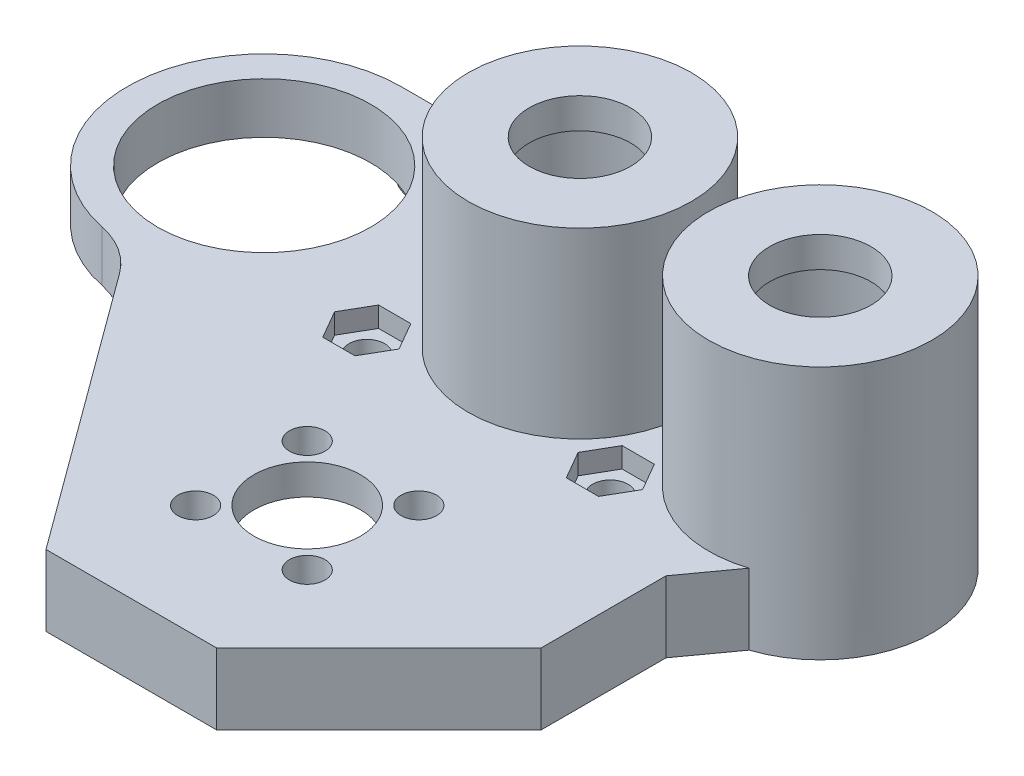
from build123d import *

# Parameters (mm, degrees)
SKETCH3_R               = 8
SKETCH3_W               = 54.803
SKETCH3_H               = 30
SKETCH3_R_2             = 5.25
BOSS_EXTRUDE1_DEPTH     = 7
CUT_EXTRUDE3_DEPTH      = 63.702230973
CUT_EXTRUDE3_DEPTH_BACK = 63.702230973
SKETCH4_R               = 1.75
SKETCH6_R               = 11
SKETCH6_R_2             = 8
BOSS_EXTRUDE2_DEPTH     = 15
SKETCH7_R               = 11
SKETCH7_R_2             = 5
BOSS_EXTRUDE3_DEPTH     = 3
CHAMFER1_SIZE           = 2.5
CUT_EXTRUDE4_DEPTH      = 2
CUT_EXTRUDE5_DEPTH      = 68.138437344
CUT_EXTRUDE5_DEPTH_BACK = 68.138437344
SKETCH9_R               = 1.75
CUT_EXTRUDE6_START      = -2
SKETCH10_R              = 1.75
CUT_EXTRUDE6_DEPTH      = 2
CHAMFER3_SIZE           = 30
CHAMFER3_SIZE2          = 22
CHAMFER4_SIZE           = 16
FILLET1_R               = 8
SKETCH14_R              = 11.5
SKETCH14_R_2            = 5.25
SKETCH14_R_3            = 1.75
CUT_EXTRUDE8_DEPTH      = 4
FILLET2_R               = 3


with BuildPart() as part:
    # Sketch3 → Boss-Extrude1 (new body)
    # profile 1 of 10: a face of its own
    with BuildSketch(Plane(origin=(0, 0, 0), x_dir=(1, 0, 0), z_dir=(0, 1, 0))):
        with BuildLine():
            ThreePointArc((-17.613, 0), (-21.567058454, 9.545941546), (-31.113, 13.5))
            Line((-31.113, 13.5), (-31.113, 10.5))
            ThreePointArc((-31.113, 10.5), (-23.688378798, 7.424621202), (-20.613, 0))
            ThreePointArc((-20.613, 0), (-23.688378798, -7.424621202), (-31.113, -10.5))
            Line((-31.113, -10.5), (-31.113, -13.5))
            ThreePointArc((-31.113, -13.5), (-21.567058454, -9.545941546), (-17.613, 0))
        make_face()
    # profile 2 of 10: a face of its own
    with BuildSketch(Plane(origin=(0, 0, 0), x_dir=(1, 0, 0), z_dir=(0, 1, 0))):
        with BuildLine():
            Line((-31.113, 10.5), (-31.113, 13.5))
            ThreePointArc((-31.113, 13.5), (-44.613, 0), (-31.113, -13.5))
            Line((-31.113, -13.5), (-31.113, -10.5))
            ThreePointArc((-31.113, -10.5), (-41.613, 0), (-31.113, 10.5))
        make_face()
    # profile 3 of 10: a face of its own
    with BuildSketch(Plane(origin=(0, 0, 0), x_dir=(1, 0, 0), z_dir=(0, 1, 0))):
        with BuildLine():
            Line((23.69, 13.5), (-31.113, 13.5))
            ThreePointArc((-31.113, 13.5), (-21.567058454, 9.545941546), (-17.613, 0))
            ThreePointArc((-17.613, 0), (-21.567058454, -9.545941546), (-31.113, -13.5))
            Line((-31.113, -13.5), (23.69, -13.5))
            Line((23.69, -13.5), (23.69, -11))
            ThreePointArc((23.69, -11), (12.69, 0), (23.69, 11))
            Line((23.69, 11), (23.69, 13.5))
        make_face()
        with Locations(Location((0, 0, 0), (0, 0, 270))):
            Circle(SKETCH3_R, mode=Mode.SUBTRACT)
    # profile 4 of 10: a face of its own
    with BuildSketch(Plane(origin=(0, 0, 0), x_dir=(1, 0, 0), z_dir=(0, 1, 0))):
        with BuildLine():
            ThreePointArc((-17.613, 0), (-21.567058454, 9.545941546), (-31.113, 13.5))
            Line((-31.113, 13.5), (-31.113, 10.5))
            ThreePointArc((-31.113, 10.5), (-23.688378798, 7.424621202), (-20.613, 0))
            ThreePointArc((-20.613, 0), (-23.688378798, -7.424621202), (-31.113, -10.5))
            Line((-31.113, -10.5), (-31.113, -13.5))
            ThreePointArc((-31.113, -13.5), (-21.567058454, -9.545941546), (-17.613, 0))
        make_face()
    # profile 5 of 10: a face of its own
    with BuildSketch(Plane(origin=(0, 0, 0), x_dir=(1, 0, 0), z_dir=(0, 1, 0))):
        with BuildLine():
            Line((-31.113, 10.5), (-31.113, 13.5))
            ThreePointArc((-31.113, 13.5), (-44.613, 0), (-31.113, -13.5))
            Line((-31.113, -13.5), (-31.113, -10.5))
            ThreePointArc((-31.113, -10.5), (-41.613, 0), (-31.113, 10.5))
        make_face()
    # profile 6 of 10: a face of its own
    with BuildSketch(Plane(origin=(0, 0, 0), x_dir=(1, 0, 0), z_dir=(0, 1, 0))):
        with BuildLine():
            ThreePointArc((34.69, 0), (31.468174593, 7.778174593), (23.69, 11))
            Line((23.69, 11), (23.69, 8))
            ThreePointArc((23.69, 8), (29.346854249, 5.656854249), (31.69, 0))
            ThreePointArc((31.69, 0), (29.346854249, -5.656854249), (23.69, -8))
            Line((23.69, -8), (23.69, -11))
            ThreePointArc((23.69, -11), (31.468174593, -7.778174593), (34.69, 0))
        make_face()
    # profile 7 of 10: a face of its own
    with BuildSketch(Plane(origin=(0, 0, 0), x_dir=(1, 0, 0), z_dir=(0, 1, 0))):
        with BuildLine():
            Line((23.69, 8), (23.69, 11))
            ThreePointArc((23.69, 11), (12.69, 0), (23.69, -11))
            Line((23.69, -11), (23.69, -8))
            ThreePointArc((23.69, -8), (15.69, 0), (23.69, 8))
        make_face()
    # profile 8 of 10: a face of its own
    with BuildSketch(Plane(origin=(0, 0, 0), x_dir=(1, 0, 0), z_dir=(0, 1, 0))):
        with Locations((-3.7115, -28.5)):
            Rectangle(SKETCH3_W, SKETCH3_H)
        with Locations(Location((0, -26.87, 0), (0, 0, 270))):
            Circle(SKETCH3_R_2, mode=Mode.SUBTRACT)
    # profile 9 of 10: a face of its own
    with BuildSketch(Plane(origin=(0, 0, 0), x_dir=(1, 0, 0), z_dir=(0, 1, 0))):
        with BuildLine():
            ThreePointArc((34.69, 0), (31.468174593, 7.778174593), (23.69, 11))
            Line((23.69, 11), (23.69, 8))
            ThreePointArc((23.69, 8), (29.346854249, 5.656854249), (31.69, 0))
            ThreePointArc((31.69, 0), (29.346854249, -5.656854249), (23.69, -8))
            Line((23.69, -8), (23.69, -11))
            ThreePointArc((23.69, -11), (31.468174593, -7.778174593), (34.69, 0))
        make_face()
    # profile 10 of 10: a face of its own
    with BuildSketch(Plane(origin=(0, 0, 0), x_dir=(1, 0, 0), z_dir=(0, 1, 0))):
        with BuildLine():
            Line((23.69, 8), (23.69, 11))
            ThreePointArc((23.69, 11), (12.69, 0), (23.69, -11))
            Line((23.69, -11), (23.69, -8))
            ThreePointArc((23.69, -8), (15.69, 0), (23.69, 8))
        make_face()
    extrude(amount=BOSS_EXTRUDE1_DEPTH)

    # Sketch4 → Cut-Extrude3 (cut, two sides: drawn at the far end of the back side and taken through both)
    with BuildSketch(Plane(origin=(0, 0, 0), x_dir=(1, 0, 0), z_dir=(0, 1, 0)).offset(-CUT_EXTRUDE3_DEPTH_BACK)):
        with Locations(Location((5.5, -21.37, 0), (0, 0, 270))):
            Circle(SKETCH4_R)
        with Locations(Location((5.5, -32.37, 0), (0, 0, 270))):
            Circle(SKETCH4_R)
        with Locations(Location((-5.5, -32.37, 0), (0, 0, 270))):
            Circle(SKETCH4_R)
        with Locations(Location((-5.5, -21.37, 0), (0, 0, 270))):
            Circle(SKETCH4_R)
    extrude(amount=CUT_EXTRUDE3_DEPTH + CUT_EXTRUDE3_DEPTH_BACK, mode=Mode.SUBTRACT)

    # Sketch6 → Boss-Extrude2 (add)
    # profile 1 of 2: a face of its own
    with BuildSketch(Plane(origin=(0, 7, 0), x_dir=(1, 0, 0), z_dir=(0, 1, 0))):
        with Locations(Location((23.69, 0, 0), (0, 0, 270))):
            Circle(SKETCH6_R)
        with Locations(Location((23.69, 0, 0), (0, 0, 270))):
            Circle(SKETCH6_R_2, mode=Mode.SUBTRACT)
    # profile 2 of 2: a face of its own
    with BuildSketch(Plane(origin=(0, 7, 0), x_dir=(1, 0, 0), z_dir=(0, 1, 0))):
        with Locations(Location((0, 0, 0), (0, 0, 270))):
            Circle(SKETCH6_R)
        with Locations(Location((0, 0, 0), (0, 0, 270))):
            Circle(SKETCH6_R_2, mode=Mode.SUBTRACT)
    extrude(amount=BOSS_EXTRUDE2_DEPTH)

    # Sketch7 → Boss-Extrude3 (add)
    # profile 1 of 2: a face of its own
    with BuildSketch(Plane(origin=(0, 22, 0), x_dir=(1, 0, 0), z_dir=(0, 1, 0))):
        with Locations(Location((23.69, 0, 0), (0, 0, 270))):
            Circle(SKETCH7_R)
        with Locations(Location((23.69, 0, 0), (0, 0, 270))):
            Circle(SKETCH7_R_2, mode=Mode.SUBTRACT)
    # profile 2 of 2: a face of its own
    with BuildSketch(Plane(origin=(0, 22, 0), x_dir=(1, 0, 0), z_dir=(0, 1, 0))):
        with Locations(Location((0, 0, 0), (0, 0, 270))):
            Circle(SKETCH7_R)
        with Locations(Location((0, 0, 0), (0, 0, 270))):
            Circle(SKETCH7_R_2, mode=Mode.SUBTRACT)
    extrude(amount=BOSS_EXTRUDE3_DEPTH)

    # Chamfer1
    # the kernel refuses this chamfer: 2.5 mm, written as the material it adds along each edge
    with BuildSketch(Plane(origin=(23.69, 0, -11), x_dir=(0.9912092295509807, 0, 0.13230367815352426), z_dir=(0, 1, 0))) as chamfer1_piece_1_section:
        with BuildLine():
            Line((2.910680919, 0), (-CHAMFER1_SIZE * 0.132303678154, CHAMFER1_SIZE * 0.991209229551))
            Line((-CHAMFER1_SIZE * 0.132303678154, CHAMFER1_SIZE * 0.991209229551), (0, 0))
            ThreePointArc((0, 0), (1.49552658, 0.096625069), (2.910680919, 0))
        make_face()
    chamfer1_piece_1 = extrude(amount=7, mode=Mode.PRIVATE)
    chamfer1_piece_1 = split(chamfer1_piece_1, bisect_by=Plane(origin=(23.69, 0, -13.5), z_dir=(0, 0, 1)), keep=Keep.TOP, mode=Mode.PRIVATE)
    add(chamfer1_piece_1)

    # Sketch8 → Cut-Extrude4 (cut)
    with BuildSketch(Plane(origin=(0, 0, 0), x_dir=(1, 0, 0), z_dir=(0, 1, 0))):
        Polygon((-31.113, -12.25), (-31.113, 0), (-31.113, 12.25), (-31.113, 13.5), (-51.113, 13.5), (-51.113, -13.5), (-31.113, -13.5), align=None)
        Polygon((-31.113, 12.25), (-31.113, 0), (-31.113, -12.25), (-13.613, -6.5), (-13.613, 6.5), align=None)
    extrude(amount=CUT_EXTRUDE4_DEPTH, mode=Mode.SUBTRACT)

    # Sketch9 → Cut-Extrude5 (cut, two sides: drawn at the far end of the back side and taken through both)
    with BuildSketch(Plane(origin=(0, 0, 0), x_dir=(1, 0, 0), z_dir=(0, 1, 0)).offset(-CUT_EXTRUDE5_DEPTH_BACK)):
        with Locations(Location((12, 9, 0), (0, 0, 90))):
            Circle(SKETCH9_R)
        with Locations(Location((12, -9, 0), (0, 0, 90))):
            Circle(SKETCH9_R)
        with Locations(Location((-12, -9, 0), (0, 0, 90))):
            Circle(SKETCH9_R)
        with Locations(Location((-12, 9, 0), (0, 0, 90))):
            Circle(SKETCH9_R)
    extrude(amount=CUT_EXTRUDE5_DEPTH + CUT_EXTRUDE5_DEPTH_BACK, mode=Mode.SUBTRACT)

    # Sketch10 → Cut-Extrude6 (cut)
    # profile 1 of 4: a face of its own
    with BuildSketch(Plane(origin=(0, 7, 0), x_dir=(1, 0, 0), z_dir=(0, 1, 0)).offset(CUT_EXTRUDE6_START)):
        Polygon((-15.175426481, -9), (-13.58771324, -11.75), (-10.41228676, -11.75), (-8.824573519, -9), (-10.41228676, -6.25), (-13.58771324, -6.25), align=None)
        with Locations(Location((-12, -9, 0), (0, 0, 90))):
            Circle(SKETCH10_R, mode=Mode.SUBTRACT)
    # profile 2 of 4: a face of its own
    with BuildSketch(Plane(origin=(0, 7, 0), x_dir=(1, 0, 0), z_dir=(0, 1, 0)).offset(CUT_EXTRUDE6_START)):
        Polygon((-15.175426481, 9), (-13.58771324, 6.25), (-10.41228676, 6.25), (-8.824573519, 9), (-10.41228676, 11.75), (-13.58771324, 11.75), align=None)
        with Locations(Location((-12, 9, 0), (0, 0, 90))):
            Circle(SKETCH10_R, mode=Mode.SUBTRACT)
    # profile 3 of 4: a face of its own
    with BuildSketch(Plane(origin=(0, 7, 0), x_dir=(1, 0, 0), z_dir=(0, 1, 0)).offset(CUT_EXTRUDE6_START)):
        Polygon((15.175426481, 9), (13.58771324, 11.75), (10.41228676, 11.75), (8.824573519, 9), (10.41228676, 6.25), (13.58771324, 6.25), align=None)
        with Locations(Location((12, 9, 0), (0, 0, 90))):
            Circle(SKETCH10_R, mode=Mode.SUBTRACT)
    # profile 4 of 4: a face of its own
    with BuildSketch(Plane(origin=(0, 7, 0), x_dir=(1, 0, 0), z_dir=(0, 1, 0)).offset(CUT_EXTRUDE6_START)):
        Polygon((15.175426481, -9), (13.58771324, -6.25), (10.41228676, -6.25), (8.824573519, -9), (10.41228676, -11.75), (13.58771324, -11.75), align=None)
        with Locations(Location((12, -9, 0), (0, 0, 90))):
            Circle(SKETCH10_R, mode=Mode.SUBTRACT)
    extrude(amount=CUT_EXTRUDE6_DEPTH, mode=Mode.SUBTRACT)

    # Chamfer2
    # the kernel refuses this chamfer: 5 mm, written as the material it adds along each edge
    with BuildSketch(Plane(origin=(23.69, 0, 11), x_dir=(0.9874000606639179, 0, -0.15824386307497393), z_dir=(0, 1, 0))) as chamfer2_piece_1:
        with BuildLine():
            Line((3.622786344, 0.141421356), (-0.805837357, -4.287202344))
            Line((-0.805837357, -4.287202344), (-0.904577363, -4.271377958))
            ThreePointArc((-0.904577363, -4.271377958), (-0.443767224, -2.137054655), (-0.098740006, 0.015824386))
            Line((-0.098740006, 0.015824386), (0.015824386, 0.098740006))
            ThreePointArc((0.015824386, 0.098740006), (1.81210794, -0.038365312), (3.606961958, 0.240161362))
            Line((3.606961958, 0.240161362), (3.622786344, 0.141421356))
        make_face()
    extrude(amount=7)

    # Chamfer3
    chamfer3_edges = [part.edges().sort_by_distance(p)[0] for p in [
        (-31.113, 3.5, 43.5),
    ]]
    chamfer3_side = [part.faces().sort_by_distance(p)[0] for p in [
        (-31.113, 3.470588235, 28.316176471),
    ]]
    chamfer(chamfer3_edges, length=CHAMFER3_SIZE, length2=CHAMFER3_SIZE2, reference=chamfer3_side[0])

    # Chamfer4
    chamfer4_edges = [part.edges().sort_by_distance(p)[0] for p in [
        (23.69, 3.5, 43.5),
    ]]
    chamfer(chamfer4_edges, length=CHAMFER4_SIZE)

    # Fillet1
    fillet1_edges = [part.edges().sort_by_distance(p)[0] for p in [
        (-31.113, 4.5, 13.5),
    ]]
    fillet(fillet1_edges, radius=FILLET1_R)

    # Sketch14 → Cut-Extrude8 (cut)
    with BuildSketch(Plane.XZ):
        with Locations(Location((0, 26.87, 0), (0, 0, 270))):
            Circle(SKETCH14_R)
        with Locations(Location((0, 26.87, 0), (0, 0, 270))):
            Circle(SKETCH14_R_2, mode=Mode.SUBTRACT)
        with Locations(Location((5.5, 32.37, 0), (0, 0, 270))):
            Circle(SKETCH14_R_3, mode=Mode.SUBTRACT)
        with Locations(Location((-5.5, 21.37, 0), (0, 0, 270))):
            Circle(SKETCH14_R_3, mode=Mode.SUBTRACT)
        with Locations(Location((-5.5, 32.37, 0), (0, 0, 270))):
            Circle(SKETCH14_R_3, mode=Mode.SUBTRACT)
        with Locations(Location((5.5, 21.37, 0), (0, 0, 270))):
            Circle(SKETCH14_R_3, mode=Mode.SUBTRACT)
    extrude(amount=-CUT_EXTRUDE8_DEPTH, mode=Mode.SUBTRACT)

    # Fillet2
    # the kernel refuses this fillet: 3 mm, written as the material it takes off along each edge
    with BuildSketch(Plane(origin=(-31.113, -5.001031038, -12.25), x_dir=(0.9500317490404903, 0, 0.3121532889704462), z_dir=(0, 1, 0))) as fillet2_piece_1:
        with BuildLine():
            CenterArc((2.000412415, 3), FILLET2_R, 217.167948486, 52.832051514)
            Line((-0.390191611, 1.187539686), (-0.438003692, 1.15129048))
            ThreePointArc((-0.438003692, 1.15129048), (-0.252097711, 0.575040646), (-0.057001905, -0.018729197))
            Line((-0.057001905, -0.018729197), (0, -0.06))
            Line((0, -0.06), (2.000412415, -0.06))
            Line((2.000412415, -0.06), (2.000412415, 0))
        make_face()
    extrude(amount=7.001031038, mode=Mode.SUBTRACT)
    with BuildSketch(Plane(origin=(-31.113, -5.001031038, 12.25), x_dir=(0, 0, 1), z_dir=(0, 1, 0))) as fillet2_piece_2:
        with BuildLine():
            CenterArc((2.225659932, 2.836915173), FILLET2_R, 198.1890457, 52.832051514)
            Line((-0.624435315, 1.900455306), (-0.68143722, 1.881726108))
            Line((-0.68143722, 1.881726108), (-0.057001905, -0.018729197))
            Line((-0.057001905, -0.018729197), (0, -0.06))
            ThreePointArc((0, -0.06), (0.625, -0.06), (1.230486801, -0.056738303))
            Line((1.230486801, -0.056738303), (1.25, 0))
        make_face()
    extrude(amount=7.001031038, mode=Mode.SUBTRACT)


solid = part.part
